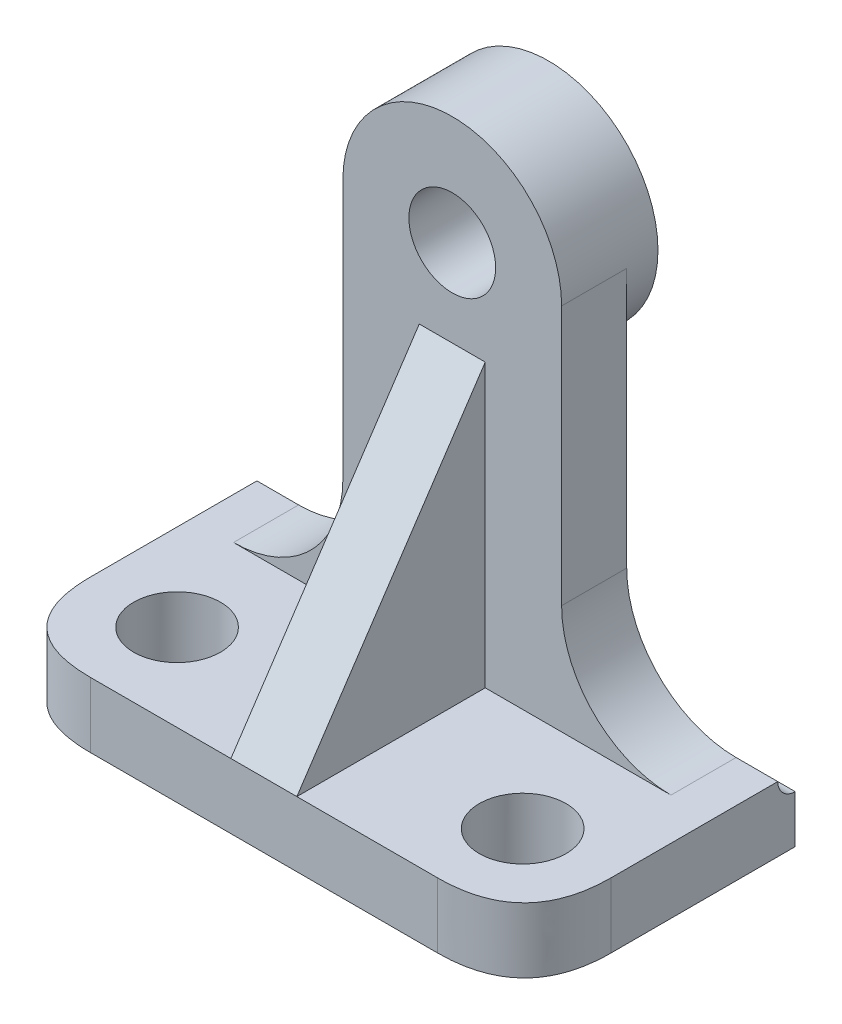
from build123d import *

# Parameters (mm, degrees)
SKETCH1_W                  = 76.2
SKETCH1_H                  = 39.624
BOSS_EXTRUDE1_DEPTH        = 9.525
CUT_EXTRUDE1_DEPTH         = 80.307508907
FILLET1_SIZE               = 12.7
SKETCH12_R                 = 6.35
BOSS_EXTRUDE4_DEPTH        = 9.525
BOSS_EXTRUDE5_START        = -14.097
SKETCH13_R                 = 16.002
BOSS_EXTRUDE5_DEPTH        = 14.097
SKETCH14_R                 = 6.35
CUT_EXTRUDE4_DEPTH         = 85.308297475
BOSS_EXTRUDE6_DEPTH        = 4.826
F_3_8_0_5_DIAMETER_HOLE1_D = 12.7


with BuildPart() as part:
    # Sketch1 → Boss-Extrude1 (new body)
    with BuildSketch(Plane(origin=(0, 0, 0), x_dir=(1, 0, 0), z_dir=(0, 1, 0))):
        Rectangle(SKETCH1_W, SKETCH1_H)
    extrude(amount=-BOSS_EXTRUDE1_DEPTH)

    # Sketch2 → Cut-Extrude1 (cut, through all)
    with BuildSketch(Plane(origin=(38.1, 0, 0), x_dir=(0, 0, -1), z_dir=(1, 0, 0))):
        with BuildLine():
            Line((17.272, 0), (19.812, 0))
            Line((19.812, 0), (19.812, -2.54))
            ThreePointArc((19.812, -2.54), (18.015948776, -1.796051224), (17.272, 0))
        make_face()
    extrude(amount=-CUT_EXTRUDE1_DEPTH, mode=Mode.SUBTRACT)

    # Fillet1
    # a fillet whose section is not a circle: 12.7 mm, written as the material it takes off along each edge
    with BuildSketch(Plane(origin=(-38.1, 31.75, 19.812), x_dir=(1, 0, 0), z_dir=(0, -1, 0))) as fillet1_piece_1:
        with BuildLine():
            Bezier((FILLET1_SIZE, 0), (0, 0), (0, -FILLET1_SIZE), weights=[1, 1, 1])
            Line((0, -FILLET1_SIZE), (0, 0))
            Line((0, 0), (FILLET1_SIZE, 0))
        make_face()
    extrude(amount=73.025, mode=Mode.SUBTRACT)
    with BuildSketch(Plane(origin=(38.1, 31.75, 19.812), x_dir=(-1, 0, 0), z_dir=(0, -1, 0))) as fillet1_piece_2:
        with BuildLine():
            Bezier((FILLET1_SIZE, 0), (0, 0), (0, FILLET1_SIZE), weights=[1, 1, 1])
            Line((0, FILLET1_SIZE), (0, 0))
            Line((0, 0), (FILLET1_SIZE, 0))
        make_face()
    extrude(amount=73.025, mode=Mode.SUBTRACT)

    # Sketch12 → Boss-Extrude4 (add)
    with BuildSketch(Plane.XY.offset(-17.272)):
        with BuildLine():
            Line((-16.002, 53.975), (-16.002, 16.002))
            ThreePointArc((-16.002, 16.002), (-20.688877287, 4.686877287), (-32.004, 0))
            Line((-32.004, 0), (32.004, 0))
            ThreePointArc((32.004, 0), (20.688877287, 4.686877287), (16.002, 16.002))
            Line((16.002, 16.002), (16.002, 53.975))
            ThreePointArc((16.002, 53.975), (0, 69.977), (-16.002, 53.975))
        make_face()
        with Locations(Location((0, 53.975, 0), (0, 0, 180))):
            Circle(SKETCH12_R, mode=Mode.SUBTRACT)
    extrude(amount=BOSS_EXTRUDE4_DEPTH)

    # Sketch13 → Boss-Extrude5 (add)
    with BuildSketch(Plane.XY.offset(-7.747).offset(BOSS_EXTRUDE5_START)):
        with Locations((0, 53.975)):
            Circle(SKETCH13_R)
    extrude(amount=BOSS_EXTRUDE5_DEPTH)

    # Sketch14 → Cut-Extrude4 (cut, through all)
    with BuildSketch(Plane.XY.offset(-7.747)):
        with Locations((0, 53.975)):
            Circle(SKETCH14_R)
    extrude(amount=-CUT_EXTRUDE4_DEPTH, mode=Mode.SUBTRACT)

    # Sketch15 → Boss-Extrude6 (add, symmetric)
    with BuildSketch(Plane(origin=(0, 0, 0), x_dir=(0, 0, -1), z_dir=(1, 0, 0))):
        Polygon((7.747, 0), (7.747, 41.275), (-19.812, 0), align=None)
    extrude(amount=BOSS_EXTRUDE6_DEPTH, both=True)

    # 3/8 (0.5) Diameter Hole1 (through all)
    with Locations(Plane(origin=(-25.4, 0, 7.112), x_dir=(0, 0, 1), z_dir=(0, 1, 0))):
        with Locations((0, 0), (0.238495024, 50.799440156)):
            Hole(F_3_8_0_5_DIAMETER_HOLE1_D / 2)


solid = part.part
